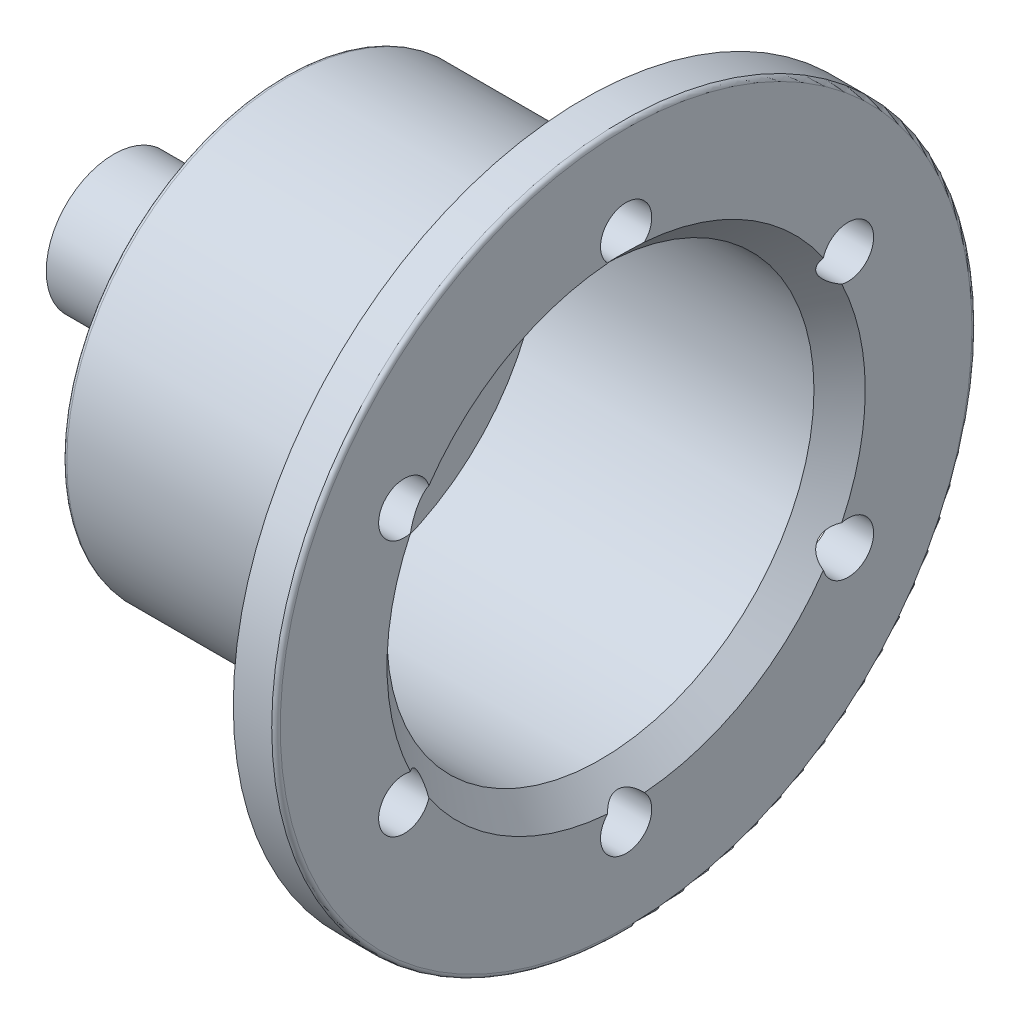
from build123d import *

# Parameters (mm, degrees)
SKETCH1_R           = 41
SKETCH1_R_2         = 3
BOSS_EXTRUDE1_DEPTH = 40
SKETCH2_R           = 7.9
BOSS_EXTRUDE2_DEPTH = 20
FILLET1_R           = 10
FILLET2_R           = 0.5
SKETCH3_R           = 57.838297584
SKETCH3_R_2         = 26
CUT_EXTRUDE1_DEPTH  = 35
FILLET3_R           = 4
FILLET4_R           = 0.5
SKETCH5_R           = 25
CUT_EXTRUDE2_DEPTH  = 35
CHAMFER1_SIZE       = 3


with BuildPart() as part:
    # Sketch1 → Boss-Extrude1 (new body)
    with BuildSketch(Plane(origin=(0, 0, 0), x_dir=(0, 0, -1), z_dir=(1, 0, 0))):
        Circle(SKETCH1_R)
        with Locations((0, 30)):
            Circle(SKETCH1_R_2, mode=Mode.SUBTRACT)
        with Locations((25.980762114, 15)):
            Circle(SKETCH1_R_2, mode=Mode.SUBTRACT)
        with Locations((25.980762114, -15)):
            Circle(SKETCH1_R_2, mode=Mode.SUBTRACT)
        with Locations((0, -30)):
            Circle(SKETCH1_R_2, mode=Mode.SUBTRACT)
        with Locations((-25.980762114, -15)):
            Circle(SKETCH1_R_2, mode=Mode.SUBTRACT)
        with Locations((-25.980762114, 15)):
            Circle(SKETCH1_R_2, mode=Mode.SUBTRACT)
    extrude(amount=BOSS_EXTRUDE1_DEPTH)

    # Sketch2 → Boss-Extrude2 (add)
    with BuildSketch(Plane.ZY):
        with Locations(Location((0, 0, 0), (0, 0, 180))):
            Circle(SKETCH2_R)
    extrude(amount=BOSS_EXTRUDE2_DEPTH)

    # Fillet1
    fillet1_edges = [part.edges().sort_by_distance(p)[0] for p in [
        (0, 0, 7.9),
    ]]
    fillet(fillet1_edges, radius=FILLET1_R)

    # Fillet2
    fillet2_edges = [part.edges().sort_by_distance(p)[0] for p in [
        (0, 0, 41),
        (40, 0, 41),
    ]]
    fillet(fillet2_edges, radius=FILLET2_R)

    # Sketch3 → Cut-Extrude1 (cut)
    with BuildSketch(Plane(origin=(0, 0, 0), x_dir=(0, 0, -1), z_dir=(1, 0, 0))):
        Circle(SKETCH3_R)
        Circle(SKETCH3_R_2, mode=Mode.SUBTRACT)
    extrude(amount=CUT_EXTRUDE1_DEPTH, mode=Mode.SUBTRACT)

    # Fillet3
    # the kernel refuses this fillet: 4 mm, written as the material it adds along each edge
    with BuildSketch(Plane(origin=(35, 0, 0), x_dir=(0, 0, -1), z_dir=(0, -1, 0))) as fillet3_piece_1_section:
        with BuildLine():
            CenterArc((26 + FILLET3_R, -FILLET3_R), FILLET3_R, 90, 90)
            Line((26 + FILLET3_R, 0), (26, 0))
            Line((26, 0), (26, -FILLET3_R))
        make_face()
    fillet3_piece_1 = revolve(axis=Axis((35, 0, 0), (1, 0, 0)), mode=Mode.PRIVATE)
    fillet3_piece_1 = fillet3_piece_1 - Plane(origin=(33.889931495, -15, 25.980762114), x_dir=(0, 0, -1), z_dir=(-1, 0, 0)) * Cylinder(3, 120, mode=Mode.PRIVATE)
    fillet3_piece_1 = fillet3_piece_1 - Plane(origin=(33.889931495, -30, 0), x_dir=(0, 0, -1), z_dir=(-1, 0, 0)) * Cylinder(3, 120, mode=Mode.PRIVATE)
    fillet3_piece_1 = fillet3_piece_1 - Plane(origin=(33.889931495, -15, -25.980762114), x_dir=(0, 0, -1), z_dir=(-1, 0, 0)) * Cylinder(3, 120, mode=Mode.PRIVATE)
    fillet3_piece_1 = fillet3_piece_1 - Plane(origin=(33.889931495, 15, 25.980762114), x_dir=(0, 0, -1), z_dir=(-1, 0, 0)) * Cylinder(3, 120, mode=Mode.PRIVATE)
    fillet3_piece_1 = fillet3_piece_1 - Plane(origin=(33.889931495, 15, -25.980762114), x_dir=(0, 0, -1), z_dir=(-1, 0, 0)) * Cylinder(3, 120, mode=Mode.PRIVATE)
    fillet3_piece_1 = fillet3_piece_1 - Plane(origin=(33.889931495, 30, 0), x_dir=(0, 0, -1), z_dir=(-1, 0, 0)) * Cylinder(3, 120, mode=Mode.PRIVATE)
    add(fillet3_piece_1)

    # Fillet4
    fillet4_edges = [part.edges().sort_by_distance(p)[0] for p in [
        (0, 0, 26),
    ]]
    fillet(fillet4_edges, radius=FILLET4_R)

    # Sketch5 → Cut-Extrude2 (cut)
    with BuildSketch(Plane(origin=(40, 0, 0), x_dir=(0, 0, -1), z_dir=(1, 0, 0))):
        Circle(SKETCH5_R)
    extrude(amount=-CUT_EXTRUDE2_DEPTH, mode=Mode.SUBTRACT)

    # Chamfer1
    # the kernel refuses this chamfer: 3 mm, written as the material it takes off along each edge
    with BuildSketch(Plane(origin=(40, 0, 0), x_dir=(0, 0, -1), z_dir=(0, -1, 0))) as chamfer1_piece_1:
        Polygon((25 + CHAMFER1_SIZE, 0), (25, -CHAMFER1_SIZE), (25, 0), align=None)
    revolve(axis=Axis((40, 0, 0), (1, 0, 0)), mode=Mode.SUBTRACT)


solid = part.part
